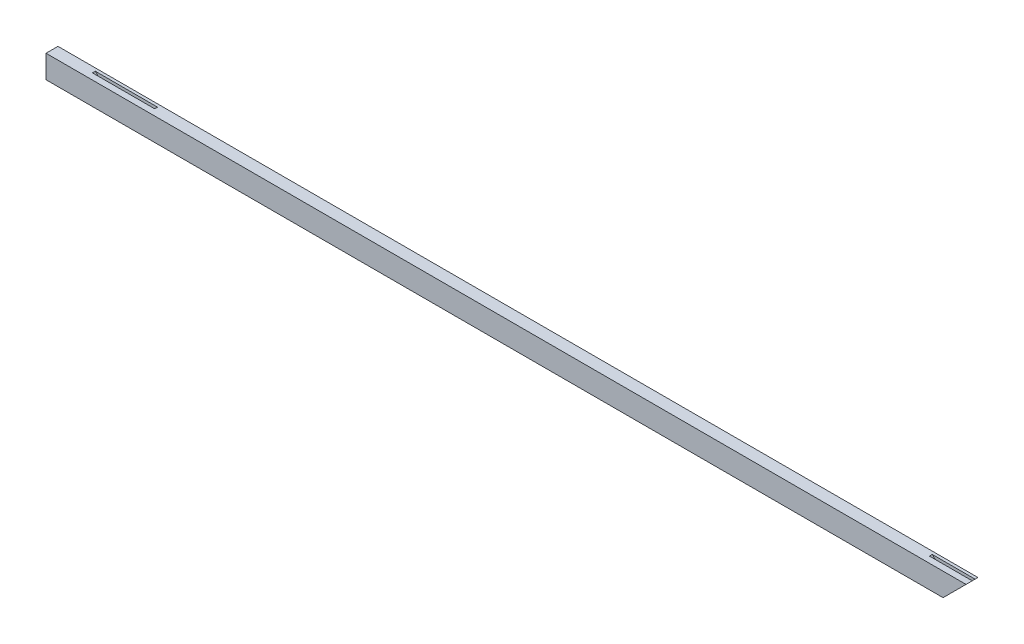
from build123d import *

# Parameters (mm, degrees)
EXTRUDE_1_DEPTH     = 25
SKETCH_2_W          = 115
SKETCH_2_H          = 6
CUT_EXTRUDE_1_DEPTH = 7.5
DRAFT_1_ANGLE       = 45
MIRROR_START        = 6
MIRROR_1_DEPTH      = 6
CUT_EXTRUDE_START   = -13
CUT_EXTRUDE_2_DEPTH = 6


# Read off the part's stored shape, not the designer's step: 镜向1
with BuildPart() as part:
    # 草图1 → 凸台-拉伸1 (new body)
    with BuildSketch(Plane.XY):
        Polygon((0, 24), (1922, 24), (1874, -24), (0, -24), align=None)
    extrude(amount=EXTRUDE_1_DEPTH)

    # 草图2 → 切除-拉伸1 (cut)
    with BuildSketch(Plane.XZ.offset(24)):
        with Locations((149, 9)):
            Rectangle(SKETCH_2_W, SKETCH_2_H)
    extrude(amount=-CUT_EXTRUDE_1_DEPTH, mode=Mode.SUBTRACT)

    # 拔模1
    draft_1_faces = [part.faces().sort_by_distance(p)[0] for p in [
        (206.5, -20.25, 9),
        (91.5, -20.25, 9),
    ]]
    draft(draft_1_faces, Plane(origin=(0, -16.5, 0), x_dir=(-1, 0, 0), z_dir=(0, -1, 0)), DRAFT_1_ANGLE)

    # 镜向1 outline → 镜向1 (cut)
    with BuildSketch(Plane.XY.offset(MIRROR_START)):
        Polygon((84, 24), (91.5, 16.5), (206.5, 16.5), (214, 24), align=None)
    extrude(amount=MIRROR_1_DEPTH, mode=Mode.SUBTRACT)

    # 草图3 → 切除-拉伸2 (cut)
    with BuildSketch(Plane.XY.offset(25).offset(CUT_EXTRUDE_START)):
        Polygon((1832.5, 24), (1840, 16.5), (1914.5, 16.5), (1922, 24), align=None)
        Polygon((1832.5, -24), (1840, -16.5), (1881.5, -16.5), (1874, -24), align=None)
    extrude(amount=-CUT_EXTRUDE_2_DEPTH, mode=Mode.SUBTRACT)


solid = part.part
